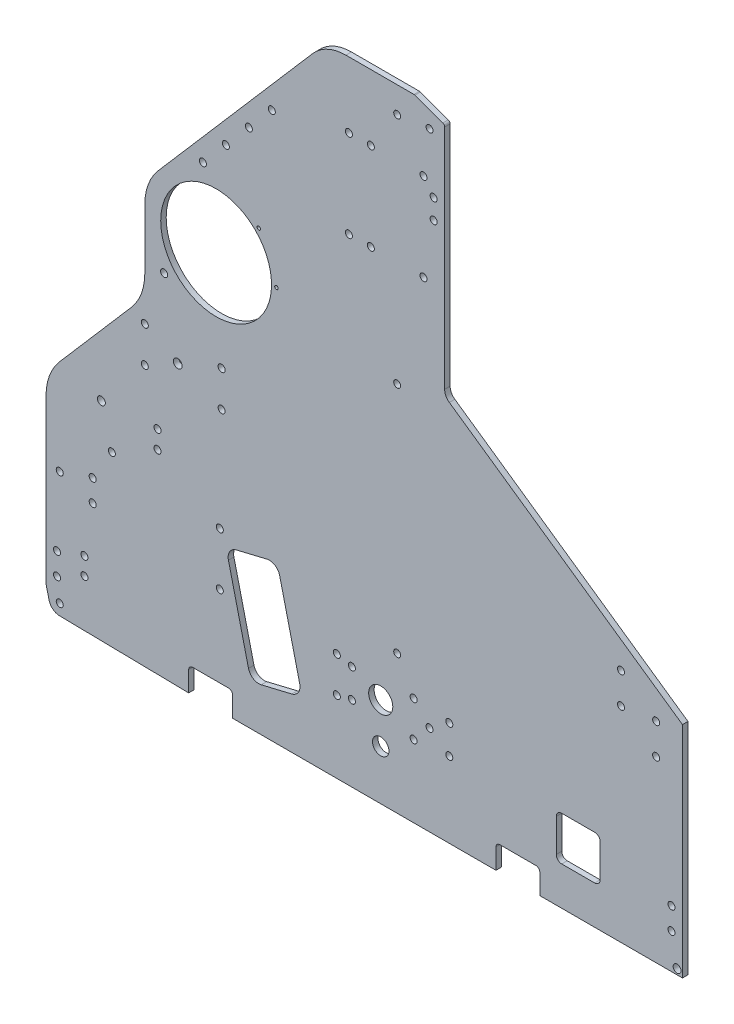
from build123d import *

# Parameters (mm, degrees)
SKETCH1_R           = 2.032
SKETCH1_R_2         = 2.54
SKETCH1_R_3         = 2
BOSS_EXTRUDE1_DEPTH = 3.175
FILLET1_R           = 2.286
FILLET2_R           = 6.35
SKETCH2_R           = 2.032
CUT_EXTRUDE1_DEPTH  = 505.524983177
FILLET3_R           = 1.5875
SKETCH3_R           = 2.032
SKETCH3_R_2         = 2.286
SKETCH3_R_3         = 1.016
CUT_EXTRUDE2_DEPTH  = 505.524983177
SKETCH4_R           = 2.032
SKETCH4_R_2         = 6.985
SKETCH4_R_3         = 4.7625
CUT_EXTRUDE3_DEPTH  = 505.524983177
SKETCH5_R           = 32.0675
SKETCH5_R_2         = 2.286000001
CUT_EXTRUDE5_DEPTH  = 505.524983177
FILLET4_R           = 31.75
CUT_EXTRUDE6_DEPTH  = 505.524983177
FILLET5_R           = 25.4
SKETCH8_R           = 2.032
CUT_EXTRUDE7_DEPTH  = 505.524983177


with BuildPart() as part:
    # Sketch1 → Boss-Extrude1 (new body)
    with BuildSketch(Plane.XY):
        with BuildLine():
            Line((7.829508682, -19.049081656), (82.55, -20.32))
            Line((82.55, -20.32), (82.55, -6.35))
            Line((82.55, -6.35), (107.95, -6.35))
            Line((107.95, -6.35), (107.95, -20.32))
            Line((107.95, -20.32), (260.35, -20.32))
            Line((260.35, -20.32), (260.35, -6.35))
            Line((260.35, -6.35), (285.75, -6.35))
            Line((285.75, -6.35), (285.75, -20.32))
            Line((285.75, -20.32), (368.3, -20.32))
            Line((368.3, -20.32), (368.3, 106.68))
            Line((368.3, 106.68), (230.66375, 202.565))
            Line((230.66375, 202.565), (230.66375, 338.455))
            Line((230.66375, 338.455), (213.19998, 344.805))
            Line((213.19998, 344.805), (203.2, 344.805))
            Line((203.2, 344.805), (161.925, 344.805))
            Line((161.925, 344.805), (52.720122664, 218.469945827))
            ThreePointArc((52.720122664, 218.469945827), (52.803835479, 218.142145922), (52.832, 217.805))
            ThreePointArc((52.832, 217.805), (52.095493096, 216.239521914), (50.419872403, 215.808871996))
            Line((50.419872403, 215.808871996), (0, 157.48))
            Line((0, 157.48), (0, 0))
            Line((0, 0), (0, -6.35))
            ThreePointArc((0, -6.35), (0.047577015, -7.125863724), (0.189595124, -7.890101219))
            Line((0.189595124, -7.890101219), (1.777095124, -14.240101219))
            ThreePointArc((1.777095124, -14.240101219), (3.987212552, -17.671692778), (7.829508682, -19.049081656))
        make_face()
        with Locations((7.9375, -12.7)):
            Circle(SKETCH1_R, mode=Mode.SUBTRACT)
        with Locations((6.35, 0)):
            Circle(SKETCH1_R, mode=Mode.SUBTRACT)
        with Locations((6.35, 12.7)):
            Circle(SKETCH1_R, mode=Mode.SUBTRACT)
        with Locations((38.1, 78.105)):
            Circle(SKETCH1_R, mode=Mode.SUBTRACT)
        with Locations((57.15, 131.28625)):
            Circle(SKETCH1_R, mode=Mode.SUBTRACT)
        with Locations((57.15, 151.92375)):
            Circle(SKETCH1_R, mode=Mode.SUBTRACT)
        with Locations((76.2, 141.605)):
            Circle(SKETCH1_R_2, mode=Mode.SUBTRACT)
        with Locations((101.6, 131.28625)):
            Circle(SKETCH1_R, mode=Mode.SUBTRACT)
        with Locations((101.6, 151.92375)):
            Circle(SKETCH1_R, mode=Mode.SUBTRACT)
        with Locations((203.2, 59.805)):
            Circle(SKETCH1_R_3, mode=Mode.SUBTRACT)
        with Locations((361.95, 0)):
            Circle(SKETCH1_R, mode=Mode.SUBTRACT)
        with Locations((361.95, 12.7)):
            Circle(SKETCH1_R, mode=Mode.SUBTRACT)
        with Locations((353.06, 82.955052336)):
            Circle(SKETCH1_R, mode=Mode.SUBTRACT)
        with Locations((332.74, 98.195052336)):
            Circle(SKETCH1_R, mode=Mode.SUBTRACT)
        with Locations((332.74, 115.975052336)):
            Circle(SKETCH1_R, mode=Mode.SUBTRACT)
        with Locations((353.06, 100.735052336)):
            Circle(SKETCH1_R, mode=Mode.SUBTRACT)
        with Locations((68.326, 182.923674932)):
            Circle(SKETCH1_R, mode=Mode.SUBTRACT)
        with Locations((76.2, 217.805)):
            Circle(SKETCH1_R, mode=Mode.SUBTRACT)
        with Locations((90.779500502, 249.682)):
            Circle(SKETCH1_R, mode=Mode.SUBTRACT)
        with Locations((104.067838673, 265.054783374)):
            Circle(SKETCH1_R, mode=Mode.SUBTRACT)
        with Locations((117.356176844, 280.427566748)):
            Circle(SKETCH1_R, mode=Mode.SUBTRACT)
        with Locations((130.644515014, 295.800350122)):
            Circle(SKETCH1_R, mode=Mode.SUBTRACT)
        with Locations((203.2, 194.805)):
            Circle(SKETCH1_R_3, mode=Mode.SUBTRACT)
        with Locations((224.31375, 287.401)):
            Circle(SKETCH1_R, mode=Mode.SUBTRACT)
        with Locations((224.31375, 298.831)):
            Circle(SKETCH1_R, mode=Mode.SUBTRACT)
        with Locations((203.2, 329.805)):
            Circle(SKETCH1_R_3, mode=Mode.SUBTRACT)
        with Locations((221.931865, 332.105)):
            Circle(SKETCH1_R_3, mode=Mode.SUBTRACT)
    extrude(amount=BOSS_EXTRUDE1_DEPTH)

    # Fillet1
    fillet1_edges = [part.edges().sort_by_distance(p)[0] for p in [
        (285.75, -6.35, 1.5875),
        (107.95, -6.35, 1.5875),
        (260.35, -6.35, 1.5875),
        (82.55, -6.35, 1.5875),
    ]]
    fillet(fillet1_edges, radius=FILLET1_R)

    # Fillet2
    fillet2_edges = [part.edges().sort_by_distance(p)[0] for p in [
        (230.66375, 202.565, 1.5875),
    ]]
    fillet(fillet2_edges, radius=FILLET2_R)

    # Sketch2 → Cut-Extrude1 (cut, through all)
    with BuildSketch(Plane(origin=(0, 0, 0), x_dir=(-1, 0, 0), z_dir=(0, 0, -1))):
        with Locations((-100.552770272, 71.086035298)):
            Circle(SKETCH2_R)
        with Locations((-100.552770272, 40.606035298)):
            Circle(SKETCH2_R)
        with Locations((-22.225, 18.202541089)):
            Circle(SKETCH2_R)
        with Locations((-22.225, 8.042541089)):
            Circle(SKETCH2_R)
    extrude(amount=-CUT_EXTRUDE1_DEPTH, mode=Mode.SUBTRACT)

    # Fillet3
    fillet3_edges = [part.edges().sort_by_distance(p)[0] for p in [
        (230.66375, 338.455, 1.5875),
        (213.19998, 344.805, 1.5875),
    ]]
    fillet(fillet3_edges, radius=FILLET3_R)

    # Sketch3 → Cut-Extrude2 (cut, through all)
    with BuildSketch(Plane.XY.offset(3.175)):
        with BuildLine():
            Line((127.789350211, 69.359774106), (110.090750339, 65.117184968))
            ThreePointArc((110.090750339, 65.117184968), (106.287939856, 62.356288953), (105.55119507, 57.715047577))
            Line((105.55119507, 57.715047577), (117.160037875, 9.287010566))
            ThreePointArc((117.160037875, 9.287010566), (119.92093389, 5.484200083), (124.562175266, 4.747455297))
            Line((124.562175266, 4.747455297), (142.260775137, 8.990044434))
            ThreePointArc((142.260775137, 8.990044434), (146.063585621, 11.75094045), (146.800330407, 16.392181825))
            Line((146.800330407, 16.392181825), (135.191487602, 64.820218836))
            ThreePointArc((135.191487602, 64.820218836), (132.430591586, 68.62302932), (127.789350211, 69.359774106))
        make_face()
        with Locations((26.987500002, 46.953113935)):
            Circle(SKETCH3_R)
        with Locations((26.987500002, 59.653113935)):
            Circle(SKETCH3_R)
        with Locations((7.937500002, 53.303113935)):
            Circle(SKETCH3_R)
        with Locations((32.030600738, 100.810868776)):
            Circle(SKETCH3_R_2)
        with Locations((64.525942114, 102.94048958)):
            Circle(SKETCH3_R)
        with Locations((64.525942114, 92.525786339)):
            Circle(SKETCH3_R)
        with Locations((133.35, 208.228121768)):
            Circle(SKETCH3_R_3)
        with Locations((123.120704333, 232.923826101)):
            Circle(SKETCH3_R_3)
    extrude(amount=-CUT_EXTRUDE2_DEPTH, mode=Mode.SUBTRACT)

    # Sketch4 → Cut-Extrude3 (cut, through all)
    with BuildSketch(Plane.XY.offset(3.175)):
        with Locations((168.275, 42.06875)):
            Circle(SKETCH4_R)
        with Locations((212.725, 42.06875)):
            Circle(SKETCH4_R)
        with Locations((212.725, 21.43125)):
            Circle(SKETCH4_R)
        with Locations((168.275, 21.43125)):
            Circle(SKETCH4_R)
        with Locations((193.675, 31.75)):
            Circle(SKETCH4_R_2)
        with Locations((177.00498, 40.0431)):
            Circle(SKETCH4_R)
        with Locations((177.00498, 23.4569)):
            Circle(SKETCH4_R)
        with Locations((193.675, 8.466666658)):
            Circle(SKETCH4_R_3)
        with Locations((221.931865, 31.75)):
            Circle(SKETCH4_R)
        with Locations((233.36123, 23.4569)):
            Circle(SKETCH4_R)
        with Locations((233.36123, 40.0431)):
            Circle(SKETCH4_R)
    extrude(amount=-CUT_EXTRUDE3_DEPTH, mode=Mode.SUBTRACT)

    # Sketch5 → Cut-Extrude5 (cut, through all)
    with BuildSketch(Plane(origin=(0, 0, 0), x_dir=(-1, 0, 0), z_dir=(0, 0, -1))):
        Polygon((0, 157.48), (-57.15, 223.594705882), (-57.15, 165.333696112), (0, 99.218990229), align=None)
        with Locations((-98.425, 208.228121768)):
            Circle(SKETCH5_R)
        with Locations((-365.170790347, -17.190790347)):
            Circle(SKETCH5_R_2)
    extrude(amount=-CUT_EXTRUDE5_DEPTH, mode=Mode.SUBTRACT)

    # Fillet4
    fillet4_edges = [part.edges().sort_by_distance(p)[0] for p in [
        (0, 99.218990229, 1.5875),
        (57.15, 165.333696112, 1.5875),
        (57.15, 223.594705882, 1.5875),
    ]]
    fillet(fillet4_edges, radius=FILLET4_R)

    # Sketch6 → Cut-Extrude6 (cut, through all)
    with BuildSketch(Plane.XY.offset(3.175)):
        with BuildLine():
            Line((298.45, 27.305), (317.5, 27.305))
            ThreePointArc((317.5, 27.305), (319.74506403, 26.37506403), (320.675, 24.13))
            Line((320.675, 24.13), (320.675, 5.08))
            ThreePointArc((320.675, 5.08), (319.74506403, 2.83493597), (317.5, 1.905))
            Line((317.5, 1.905), (298.45, 1.905))
            ThreePointArc((298.45, 1.905), (296.20493597, 2.83493597), (295.275, 5.08))
            Line((295.275, 5.08), (295.275, 24.13))
            ThreePointArc((295.275, 24.13), (296.20493597, 26.37506403), (298.45, 27.305))
        make_face()
    extrude(amount=-CUT_EXTRUDE6_DEPTH, mode=Mode.SUBTRACT)

    # Fillet5
    fillet5_edges = [part.edges().sort_by_distance(p)[0] for p in [
        (161.925, 344.805, 1.5875),
    ]]
    fillet(fillet5_edges, radius=FILLET5_R)

    # Sketch8 → Cut-Extrude7 (cut, through all)
    with BuildSketch(Plane(origin=(0, 0, 0), x_dir=(-1, 0, 0), z_dir=(0, 0, -1))):
        with Locations((-187.96, 306.705)):
            Circle(SKETCH8_R)
        with Locations((-175.26, 306.705)):
            Circle(SKETCH8_R)
        with Locations((-218.44, 306.705)):
            Circle(SKETCH8_R)
        with Locations((-218.44, 255.905)):
            Circle(SKETCH8_R)
        with Locations((-187.96, 255.905)):
            Circle(SKETCH8_R)
        with Locations((-175.26, 255.905)):
            Circle(SKETCH8_R)
    extrude(amount=-CUT_EXTRUDE7_DEPTH, mode=Mode.SUBTRACT)


solid = part.part
